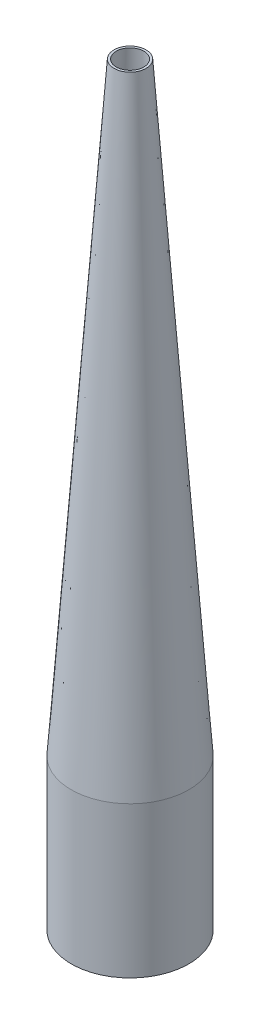
from build123d import *

# Parameters (mm, degrees)
SKETCH9_R          = 38.1
CUT_EXTRUDE2_DEPTH = 562.602673384
SKETCH3_R          = 39.624
CUT_EXTRUDE4_DEPTH = 512.081326945


# Read off the part's stored shape, not the designer's step: Shell6
with BuildPart() as part:
    # Sketch2 → Revolve1 (revolve)
    with BuildSketch(Plane.XY, mode=Mode.PRIVATE) as revolve1_sk:
        Polygon((0, 558.8), (-39.624, 0), (-39.624, -101.6), (0, -101.6), align=None)
    revolve(revolve1_sk.sketch.rotate(Axis((0, 0, 0), (0, 1, 0)), 270), axis=Axis((0, 0, 0), (0, 1, 0)))

    # Sketch9 → Cut-Extrude2 (cut, through all)
    with BuildSketch(Plane(origin=(0, 0, 0), x_dir=(1, 0, 0), z_dir=(0, 1, 0))):
        with Locations(Location((0, 0, 0), (0, 0, 270))):
            Circle(SKETCH9_R)
    extrude(amount=-CUT_EXTRUDE2_DEPTH, mode=Mode.SUBTRACT)

    # Shell6 outline → Shell6 (revolve, cut)
    with BuildSketch(Plane.XY):
        Polygon((38.096173393, 0), (0, 537.253727331), (0, 0), align=None)
    revolve(axis=Axis((0, 0, 0), (0, 1, 0)), mode=Mode.SUBTRACT)

    # Sketch3 → Cut-Extrude4 (cut, through all)
    with BuildSketch(Plane(origin=(0, 406.4, 0), x_dir=(1, 0, 0), z_dir=(0, 1, 0))):
        with Locations(Location((0, 0, 0), (0, 0, 90))):
            Circle(SKETCH3_R)
    extrude(amount=CUT_EXTRUDE4_DEPTH, mode=Mode.SUBTRACT)


solid = part.part
